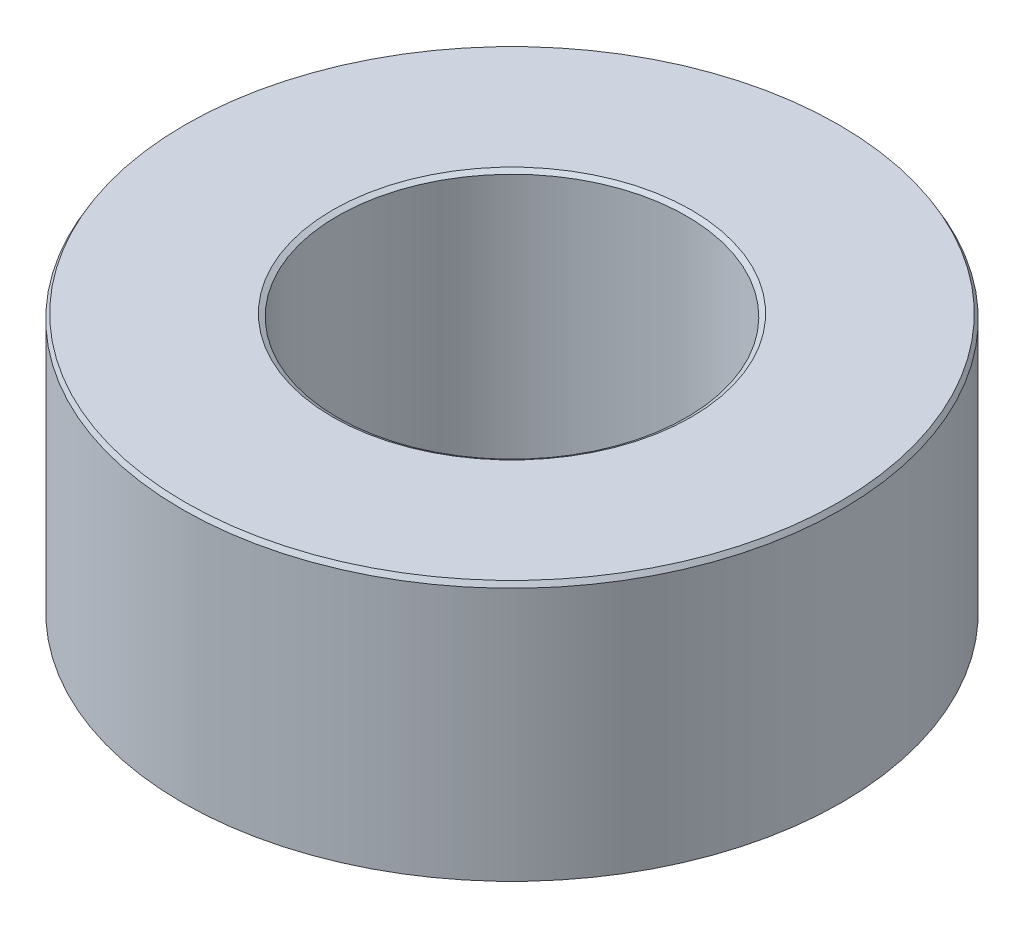
from build123d import *
from OCP.BRepFilletAPI import BRepFilletAPI_MakeChamfer

# Parameters (mm, degrees)
SKETCH1_R           = 50
BOSS_EXTRUDE1_DEPTH = 39.651053589
SKETCH2_R           = 26.467893068
CUT_EXTRUDE1_DEPTH  = 82.069143641
CHAMFER1_SIZE       = 0.732079734
CHAMFER1_SIZE2      = 0.422666431


with BuildPart() as part:
    # Sketch1 → Boss-Extrude1 (new body)
    with BuildSketch(Plane(origin=(0, 0, 0), x_dir=(1, 0, 0), z_dir=(0, 1, 0))):
        Circle(SKETCH1_R)
    extrude(amount=BOSS_EXTRUDE1_DEPTH)

    # Sketch2 → Cut-Extrude1 (cut, through all)
    with BuildSketch(Plane(origin=(0, 0, 0), x_dir=(1, 0, 0), z_dir=(0, 1, 0))):
        Circle(SKETCH2_R)
    extrude(amount=CUT_EXTRUDE1_DEPTH, mode=Mode.SUBTRACT)

    # Chamfer1: one chamfer whose edges measure the first distance from different faces: ONE call of the kernel's chamfer builder (chamfer() names one face for all edges)
    chamfer1_edges_1 = [part.edges().sort_by_distance(p)[0] for p in [
        (-26.467893068, 39.651053589, 0),
    ]]
    chamfer1_side_1 = [part.faces().sort_by_distance(p)[0] for p in [
        (-48.585786438, 39.651053589, 0),
    ]]
    chamfer1_edges_2 = [part.edges().sort_by_distance(p)[0] for p in [
        (-26.467893068, 0, 0),
    ]]
    chamfer1_side_2 = [part.faces().sort_by_distance(p)[0] for p in [
        (-26.467893068, 19.825526795, 0),
    ]]
    chamfer1_edges_3 = [part.edges().sort_by_distance(p)[0] for p in [
        (-50, 0, 0),
    ]]
    chamfer1_side_3 = [part.faces().sort_by_distance(p)[0] for p in [
        (-48.585786438, 0, 0),
    ]]
    chamfer1_edges_4 = [part.edges().sort_by_distance(p)[0] for p in [
        (-50, 39.651053589, 0),
    ]]
    chamfer1_side_4 = [part.faces().sort_by_distance(p)[0] for p in [
        (-50, 19.825526795, 0),
    ]]
    chamfer1 = BRepFilletAPI_MakeChamfer(part.part.solid().wrapped)
    for e in chamfer1_edges_1:
        chamfer1.Add(CHAMFER1_SIZE, CHAMFER1_SIZE2, e.wrapped, chamfer1_side_1[0].wrapped)  # the first distance lies on this face
    for e in chamfer1_edges_2:
        chamfer1.Add(CHAMFER1_SIZE, CHAMFER1_SIZE2, e.wrapped, chamfer1_side_2[0].wrapped)  # the first distance lies on this face
    for e in chamfer1_edges_3:
        chamfer1.Add(CHAMFER1_SIZE, CHAMFER1_SIZE2, e.wrapped, chamfer1_side_3[0].wrapped)  # the first distance lies on this face
    for e in chamfer1_edges_4:
        chamfer1.Add(CHAMFER1_SIZE, CHAMFER1_SIZE2, e.wrapped, chamfer1_side_4[0].wrapped)  # the first distance lies on this face
    add(Compound.cast(chamfer1.Shape()), mode=Mode.REPLACE)


solid = part.part
